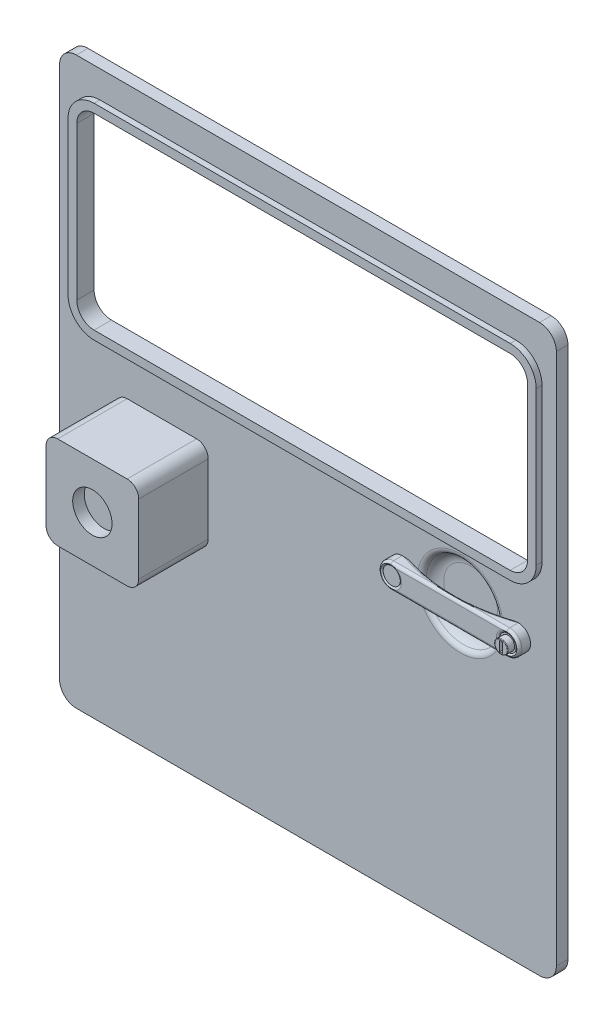
from build123d import *

# Parameters (mm, degrees)
BOSS_EXTRUDE1_DEPTH = 10
CUT_EXTRUDE1_DEPTH  = 651.441619738
BOSS_EXTRUDE2_DEPTH = 120
SKETCH5_R           = 33.985423714
CUT_EXTRUDE2_DEPTH  = 20
BOSS_EXTRUDE3_DEPTH = 20
SKETCH9_R           = 66.520860748
CUT_EXTRUDE5_DEPTH  = 18
CUT_EXTRUDE6_DEPTH  = 60
FILLET1_R           = 20
FILLET2_R           = 10
SKETCH11_R          = 14.840519461
SKETCH11_R_2        = 14.251980432
CUT_EXTRUDE7_DEPTH  = 2
SKETCH12_R          = 11.537971811
BOSS_EXTRUDE4_DEPTH = 12
SKETCH13_W          = 4.707950979
SKETCH13_H          = 17.086870266
CUT_EXTRUDE8_DEPTH  = 12
FILLET3_R           = 5
FILLET4_R           = 1
BOSS_EXTRUDE5_START = 10
BOSS_EXTRUDE5_DEPTH = 10


with BuildPart() as part:
    # Sketch1 → Boss-Extrude1 (new, symmetric)
    with BuildSketch(Plane.XY):
        with BuildLine():
            Line((429, -459.531621643), (429, 459.531621643))
            add(Edge.make_bspline(
                [(429, 459.531621643), (429, 461.424578135), (428.625853979, 465.220721823), (426.413219675, 472.511957853), (421.041418821, 480.550051014), (412.994808473, 485.916682286), (405.695517593, 488.127269147), (401.895043512, 488.501075229), (400, 488.501075229)],
                knots=[-3.141592654, -3.141592654, -3.141592654, -3.141592654, -2.945243113, -2.748893572, -2.35619449, -1.963495408, -1.767145868, -1.570796327, -1.570796327, -1.570796327, -1.570796327], degree=3))
            Line((400, 488.501075229), (-400, 488.501075229))
            add(Edge.make_bspline(
                [(-400, 488.501075229), (-401.895043512, 488.501075229), (-405.695517593, 488.127269147), (-412.994808473, 485.916682286), (-421.041418821, 480.550051014), (-426.413219675, 472.511957853), (-428.625853979, 465.220721823), (-429, 461.424578135), (-429, 459.531621643)],
                knots=[1.570796327, 1.570796327, 1.570796327, 1.570796327, 1.767145868, 1.963495408, 2.35619449, 2.748893572, 2.945243113, 3.141592654, 3.141592654, 3.141592654, 3.141592654], degree=3))
            Line((-429, 459.531621643), (-429, -459.531621643))
            add(Edge.make_bspline(
                [(-429, -459.531621643), (-429, -461.424578135), (-428.625853979, -465.220721823), (-426.413219675, -472.511957853), (-421.041418821, -480.550051014), (-412.994808473, -485.916682286), (-405.695517593, -488.127269147), (-401.895043512, -488.501075229), (-400, -488.501075229)],
                knots=[3.141592654, 3.141592654, 3.141592654, 3.141592654, 3.337942194, 3.534291735, 3.926990817, 4.319689899, 4.51603944, 4.71238898, 4.71238898, 4.71238898, 4.71238898], degree=3))
            Line((-400, -488.501075229), (400, -488.501075229))
            add(Edge.make_bspline(
                [(400, -488.501075229), (401.895043512, -488.501075229), (405.695517593, -488.127269147), (412.994808473, -485.916682286), (421.041418821, -480.550051014), (426.413219675, -472.511957853), (428.625853979, -465.220721823), (429, -461.424578135), (429, -459.531621643)],
                knots=[-1.570796327, -1.570796327, -1.570796327, -1.570796327, -1.374446786, -1.178097245, -0.785398163, -0.392699082, -0.196349541, 0, 0, 0, 0], degree=3))
        make_face()
    extrude(amount=BOSS_EXTRUDE1_DEPTH, both=True)

    # Sketch2 → Cut-Extrude1 (cut, through all)
    with BuildSketch(Plane.XY.offset(10)):
        with BuildLine():
            Line((359.219655333, 102.390536508), (-359.219655333, 102.390536508))
            ThreePointArc((-359.219655333, 102.390536508), (-380.432858769, 111.177333072), (-389.219655333, 132.390536508))
            Line((-389.219655333, 132.390536508), (-389.219655333, 396.67394534))
            ThreePointArc((-389.219655333, 396.67394534), (-380.432858769, 417.887148775), (-359.219655333, 426.67394534))
            Line((-359.219655333, 426.67394534), (359.219655333, 426.67394534))
            ThreePointArc((359.219655333, 426.67394534), (380.432858769, 417.887148775), (389.219655333, 396.67394534))
            Line((389.219655333, 396.67394534), (389.219655333, 132.390536508))
            ThreePointArc((389.219655333, 132.390536508), (380.432858769, 111.177333072), (359.219655333, 102.390536508))
        make_face()
    extrude(amount=-CUT_EXTRUDE1_DEPTH, mode=Mode.SUBTRACT)

    # Sketch4 → Boss-Extrude2 (add)
    with BuildSketch(Plane.XY.offset(10)):
        with BuildLine():
            Line((-192.246884641, -141.705555114), (-312.246884641, -141.705555114))
            ThreePointArc((-312.246884641, -141.705555114), (-326.389020265, -135.847690738), (-332.246884641, -121.705555114))
            Line((-332.246884641, -121.705555114), (-332.246884641, -1.705555114))
            ThreePointArc((-332.246884641, -1.705555114), (-326.389020265, 12.43658051), (-312.246884641, 18.294444886))
            Line((-312.246884641, 18.294444886), (-192.246884641, 18.294444886))
            ThreePointArc((-192.246884641, 18.294444886), (-178.104749017, 12.43658051), (-172.246884641, -1.705555114))
            Line((-172.246884641, -1.705555114), (-172.246884641, -121.705555114))
            ThreePointArc((-172.246884641, -121.705555114), (-178.104749017, -135.847690738), (-192.246884641, -141.705555114))
        make_face()
    extrude(amount=BOSS_EXTRUDE2_DEPTH)

    # Sketch5 → Cut-Extrude2 (cut)
    with BuildSketch(Plane.XY.offset(130)):
        with Locations((-252.246884641, -61.705555114)):
            Circle(SKETCH5_R)
    extrude(amount=-CUT_EXTRUDE2_DEPTH, mode=Mode.SUBTRACT)

    # Sketch6 → Boss-Extrude3 (add)
    with BuildSketch(Plane.XY.offset(10)):
        with BuildLine():
            Line((162.739925575, 21.02057372), (363.452500451, 21.02057372))
            ThreePointArc((363.452500451, 21.02057372), (384.473074171, 0), (363.452500451, -21.02057372))
            Line((363.452500451, -21.02057372), (162.739925575, -21.02057372))
            ThreePointArc((162.739925575, -21.02057372), (141.719351855, 0), (162.739925575, 21.02057372))
        make_face()
    extrude(amount=BOSS_EXTRUDE3_DEPTH)

    # Sketch9 → Cut-Extrude5 (cut)
    with BuildSketch(Plane.XY.offset(10)):
        with Locations((263.096213013, 0)):
            Circle(SKETCH9_R)
    extrude(amount=-CUT_EXTRUDE5_DEPTH, mode=Mode.SUBTRACT)

    # Sketch10 → Cut-Extrude6 (cut)
    with BuildSketch(Plane(origin=(0, 21.02057372, 0), x_dir=(1, 0, 0), z_dir=(0, 1, 0))):
        with BuildLine():
            Line((181.36192728, -10), (348.70143273, -10))
            ThreePointArc((348.70143273, -10), (265.031680005, -22.271497094), (181.36192728, -10))
        make_face()
    extrude(amount=-CUT_EXTRUDE6_DEPTH, mode=Mode.SUBTRACT)

    # Fillet1
    # the kernel refuses this fillet: 20 mm, written as the material it adds along each edge
    with BuildSketch(Plane(origin=(263.096213013, 0, -8), x_dir=(1, 0, 0), z_dir=(0, -1, 0))) as fillet1_piece_1:
        with BuildLine():
            CenterArc((46.621112006, 20), FILLET1_R, 270, 84.260829523)
            Line((46.621112006, 0), (46.621112006, -0.4))
            Line((46.621112006, -0.4), (66.520860748, -0.4))
            Line((66.520860748, -0.4), (66.920860748, 0))
            ThreePointArc((66.920860748, 0), (66.920860748, 9), (66.918855723, 17.96))
            Line((66.918855723, 17.96), (66.520860748, 18))
        make_face()
    revolve(axis=Axis((263.096213013, 0, -8), (0, 0, 1)))

    # Fillet2
    fillet2_edges = [part.edges().sort_by_distance(p)[0] for p in [
        (196.575352264, 0, 10),
    ]]
    fillet(fillet2_edges, radius=FILLET2_R)

    # Sketch11 → Cut-Extrude7 (cut)
    with BuildSketch(Plane.XY.offset(30)):
        with Locations((162.739925575, 0)):
            Circle(SKETCH11_R)
        with Locations((363.452500451, 0)):
            Circle(SKETCH11_R_2)
    extrude(amount=-CUT_EXTRUDE7_DEPTH, mode=Mode.SUBTRACT)

    # Sketch12 → Boss-Extrude4 (add)
    with BuildSketch(Plane.XY.offset(28)):
        with Locations((363.452500451, 0)):
            Circle(SKETCH12_R)
    extrude(amount=BOSS_EXTRUDE4_DEPTH)

    # Sketch13 → Cut-Extrude8 (cut)
    with BuildSketch(Plane.XY.offset(40)):
        with Locations((363.45250045, 0)):
            Rectangle(SKETCH13_W, SKETCH13_H)
    extrude(amount=-CUT_EXTRUDE8_DEPTH, mode=Mode.SUBTRACT)

    # Fillet3
    # the kernel refuses this fillet: 5 mm, written as the material it takes off along each edge
    with BuildSketch(Plane(origin=(265.031680005, -21.02057372, -269.103593774), x_dir=(-0.35619186433056876, 0, 0.9344128401219204), z_dir=(-0.9344128401219204, 0, -0.35619186433056876))) as fillet3_piece_1_section:
        with BuildLine():
            CenterArc((291.375090869 + FILLET3_R, FILLET3_R), FILLET3_R, 180, 90)
            Line((291.375090869, FILLET3_R), (291.375090869 - FILLET3_R * 0.02, FILLET3_R))
            Line((291.375090869 - FILLET3_R * 0.02, FILLET3_R), (291.375090869 - FILLET3_R * 0.02, -FILLET3_R * 0.02))
            Line((291.375090869 - FILLET3_R * 0.02, -FILLET3_R * 0.02), (291.375090869 + FILLET3_R, -FILLET3_R * 0.02))
            Line((291.375090869 + FILLET3_R, -FILLET3_R * 0.02), (291.375090869 + FILLET3_R, 0))
        make_face()
    fillet3_piece_1 = revolve(axis=Axis((265.031680005, -21.02057372, -269.103593774), (0, 1, 0)), revolution_arc=41.733017363, mode=Mode.PRIVATE)
    fillet3_piece_1 = split(fillet3_piece_1, bisect_by=Plane(origin=(265.031680005, -21.02057372, 10), z_dir=(0, 0, 1)), keep=Keep.TOP, mode=Mode.PRIVATE)
    add(fillet3_piece_1, mode=Mode.SUBTRACT)
    with BuildSketch(Plane(origin=(265.031680005, 21.02057372, -269.103593774), x_dir=(0.3561918643305686, 0, 0.9344128401219206), z_dir=(0.9344128401219206, 0, -0.3561918643305686))) as fillet3_piece_2_section:
        with BuildLine():
            CenterArc((291.375090869 + FILLET3_R, FILLET3_R), FILLET3_R, 180, 90)
            Line((291.375090869 + FILLET3_R, 0), (291.375090869 + FILLET3_R, -FILLET3_R * 0.02))
            Line((291.375090869 + FILLET3_R, -FILLET3_R * 0.02), (291.375090869 - FILLET3_R * 0.02, -FILLET3_R * 0.02))
            Line((291.375090869 - FILLET3_R * 0.02, -FILLET3_R * 0.02), (291.375090869 - FILLET3_R * 0.02, FILLET3_R))
            Line((291.375090869 - FILLET3_R * 0.02, FILLET3_R), (291.375090869, FILLET3_R))
        make_face()
    fillet3_piece_2 = revolve(axis=Axis((265.031680005, 21.02057372, -269.103593774), (0, -1, 0)), revolution_arc=41.733017363, mode=Mode.PRIVATE)
    fillet3_piece_2 = split(fillet3_piece_2, bisect_by=Plane(origin=(265.031680005, 21.02057372, 10), z_dir=(0, 0, 1)), keep=Keep.TOP, mode=Mode.PRIVATE)
    add(fillet3_piece_2, mode=Mode.SUBTRACT)
    with BuildSketch(Plane(origin=(162.739925575, 0, 30), x_dir=(1, 0, 0), z_dir=(0, -1, 0))) as fillet3_piece_3:
        with BuildLine():
            CenterArc((18.840519461, -5), FILLET3_R, 90, 53.130102354)
            Line((14.840519461, -2), (14.760519461, -1.94))
            ThreePointArc((14.760519461, -1.94), (14.740519461, -1), (14.740519461, 0))
            Line((14.740519461, 0), (14.840519461, 0.1))
            Line((14.840519461, 0.1), (18.840519461, 0.1))
            Line((18.840519461, 0.1), (18.840519461, 0))
        make_face()
    revolve(axis=Axis((162.739925575, 0, 30), (0, 0, 1)), mode=Mode.SUBTRACT)
    with BuildSketch(Plane(origin=(363.452500451, 0, 30), x_dir=(1, 0, 0), z_dir=(0, -1, 0))) as fillet3_piece_4:
        with BuildLine():
            CenterArc((18.251980432, -5), FILLET3_R, 90, 53.130102354)
            Line((14.251980432, -2), (14.171980432, -1.94))
            ThreePointArc((14.171980432, -1.94), (14.151980432, -1), (14.151980432, 0))
            Line((14.151980432, 0), (14.251980432, 0.1))
            Line((14.251980432, 0.1), (18.251980432, 0.1))
            Line((18.251980432, 0.1), (18.251980432, 0))
        make_face()
    revolve(axis=Axis((363.452500451, 0, 30), (0, 0, 1)), mode=Mode.SUBTRACT)
    with BuildSketch(Plane(origin=(162.739925575, 0, 30), x_dir=(0, -1, 0), z_dir=(1, 0, 0))) as fillet3_piece_5:
        with BuildLine():
            CenterArc((21.02057372 - FILLET3_R, FILLET3_R), FILLET3_R, 270, 90)
            Line((21.02057372 - FILLET3_R, 0), (21.02057372 - FILLET3_R, -FILLET3_R * 0.02))
            Line((21.02057372 - FILLET3_R, -FILLET3_R * 0.02), (21.02057372 + FILLET3_R * 0.02, -FILLET3_R * 0.02))
            Line((21.02057372 + FILLET3_R * 0.02, -FILLET3_R * 0.02), (21.02057372 + FILLET3_R * 0.02, FILLET3_R))
            Line((21.02057372 + FILLET3_R * 0.02, FILLET3_R), (21.02057372, FILLET3_R))
        make_face()
    revolve(axis=Axis((162.739925575, 0, 30), (0, 0, -1)), revolution_arc=180, mode=Mode.SUBTRACT)
    with BuildSketch(Plane(origin=(363.452500451, -21.02057372, 30), x_dir=(0, 0, -1), z_dir=(-1, 0, 0)), Plane(origin=(162.739925575, 21.02057372, 30), x_dir=(0, 0, -1), z_dir=(1, 0, 0))) as fillet3_piece_6:
        with BuildLine():
            CenterArc((FILLET3_R, -FILLET3_R), FILLET3_R, 90, 90)
            Line((0, -FILLET3_R), (-FILLET3_R * 0.02, -FILLET3_R))
            Line((-FILLET3_R * 0.02, -FILLET3_R), (-FILLET3_R * 0.02, FILLET3_R * 0.02))
            Line((-FILLET3_R * 0.02, FILLET3_R * 0.02), (FILLET3_R, FILLET3_R * 0.02))
            Line((FILLET3_R, FILLET3_R * 0.02), (FILLET3_R, 0))
        make_face()
    extrude(amount=200.712574876, mode=Mode.SUBTRACT)
    with BuildSketch(Plane(origin=(363.452500451, 0, 30), x_dir=(0, 1, 0), z_dir=(-1, 0, 0))) as fillet3_piece_7:
        with BuildLine():
            CenterArc((21.02057372 - FILLET3_R, FILLET3_R), FILLET3_R, 270, 90)
            Line((21.02057372 - FILLET3_R, 0), (21.02057372 - FILLET3_R, -FILLET3_R * 0.02))
            Line((21.02057372 - FILLET3_R, -FILLET3_R * 0.02), (21.02057372 + FILLET3_R * 0.02, -FILLET3_R * 0.02))
            Line((21.02057372 + FILLET3_R * 0.02, -FILLET3_R * 0.02), (21.02057372 + FILLET3_R * 0.02, FILLET3_R))
            Line((21.02057372 + FILLET3_R * 0.02, FILLET3_R), (21.02057372, FILLET3_R))
        make_face()
    revolve(axis=Axis((363.452500451, 0, 30), (0, 0, -1)), revolution_arc=180, mode=Mode.SUBTRACT)

    # Fillet4
    fillet4_edges = [part.edges().sort_by_distance(p)[0] for p in [
        (351.91452864, 0, 40),
    ]]
    fillet(fillet4_edges, radius=FILLET4_R)

    # Sketch14 → Boss-Extrude5 (add)
    with BuildSketch(Plane.XY.offset(10).offset(BOSS_EXTRUDE5_START)):
        with BuildLine():
            Line((404.219655333, 132.390536508), (404.219655333, 396.67394534))
            ThreePointArc((404.219655333, 396.67394534), (391.039460487, 428.493750493), (359.219655333, 441.67394534))
            Line((359.219655333, 441.67394534), (-359.219655333, 441.67394534))
            ThreePointArc((-359.219655333, 441.67394534), (-391.039460487, 428.493750493), (-404.219655333, 396.67394534))
            Line((-404.219655333, 396.67394534), (-404.219655333, 132.390536508))
            ThreePointArc((-404.219655333, 132.390536508), (-391.039460487, 100.570731354), (-359.219655333, 87.390536508))
            Line((-359.219655333, 87.390536508), (359.219655333, 87.390536508))
            ThreePointArc((359.219655333, 87.390536508), (391.039460487, 100.570731354), (404.219655333, 132.390536508))
        make_face()
        with BuildLine():
            Line((389.219655333, 132.390536508), (389.219655333, 396.67394534))
            ThreePointArc((389.219655333, 396.67394534), (380.432858769, 417.887148775), (359.219655333, 426.67394534))
            Line((359.219655333, 426.67394534), (-359.219655333, 426.67394534))
            ThreePointArc((-359.219655333, 426.67394534), (-380.432858769, 417.887148775), (-389.219655333, 396.67394534))
            Line((-389.219655333, 396.67394534), (-389.219655333, 132.390536508))
            ThreePointArc((-389.219655333, 132.390536508), (-380.432858769, 111.177333072), (-359.219655333, 102.390536508))
            Line((-359.219655333, 102.390536508), (359.219655333, 102.390536508))
            ThreePointArc((359.219655333, 102.390536508), (380.432858769, 111.177333072), (389.219655333, 132.390536508))
        make_face(mode=Mode.SUBTRACT)
    extrude(amount=-BOSS_EXTRUDE5_DEPTH)


solid = part.part
